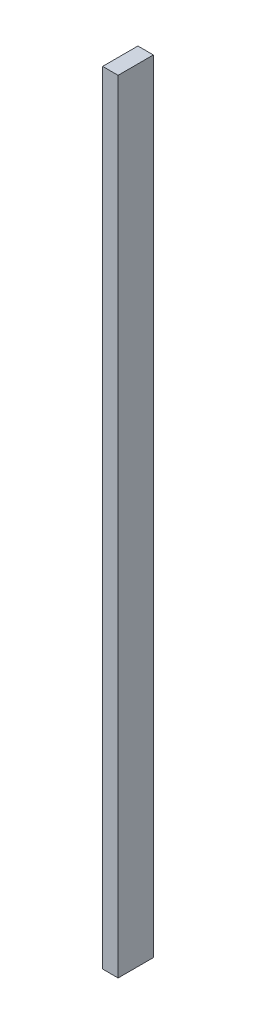
from build123d import *

# Parameters (mm, degrees)
SKETCH1_W           = 101.6
SKETCH1_H           = 231.775
BOSS_EXTRUDE1_DEPTH = 5137.15


with BuildPart() as part:
    # Sketch1 → Boss-Extrude1 (new body)
    with BuildSketch(Plane(origin=(0, 0, 0), x_dir=(1, 0, 0), z_dir=(0, 1, 0))):
        Rectangle(SKETCH1_W, SKETCH1_H)
    extrude(amount=BOSS_EXTRUDE1_DEPTH)


solid = part.part
